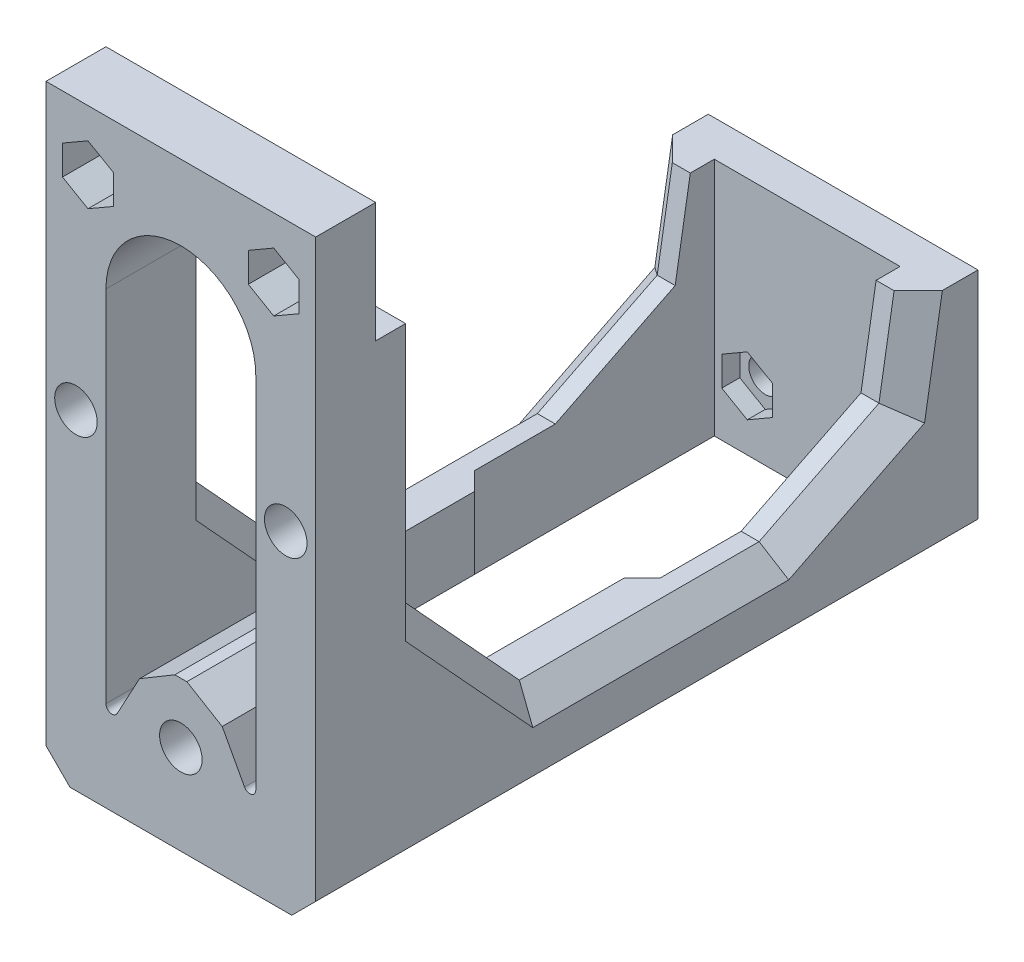
from build123d import *

# Parameters (mm, degrees)
SKETCH1_W               = 10
SKETCH1_H               = 110.5
BOSS_EXTRUDE1_DEPTH     = 100
BOSS_EXTRUDE1_2_DEPTH   = 100
SKETCH2_W               = 45
SKETCH2_H               = 40
BOSS_EXTRUDE2_DEPTH     = 6
CUT_EXTRUDE1_DEPTH      = 156.676748424
CUT_EXTRUDE1_DEPTH_BACK = 156.676748424
CHAMFER1_SIZE           = 4
CHAMFER2_SIZE           = 4
CUT_EXTRUDE2_DEPTH      = 151.71993896
CUT_EXTRUDE2_DEPTH_BACK = 6
SKETCH4_R               = 2.75
CUT_EXTRUDE3_DEPTH      = 10
CUT_EXTRUDE3_DEPTH_BACK = 3
CUT_EXTRUDE4_DEPTH      = 128.73605599
CUT_EXTRUDE4_DEPTH_BACK = 128.73605599
SKETCH6_W               = 31
SKETCH6_H               = 40
CHAMFER4_SIZE           = 3
BOSS_EXTRUDE3_DEPTH     = 15
CUT_EXTRUDE5_DEPTH      = 151.71993896
CUT_EXTRUDE5_DEPTH_BACK = 151.71993896
SKETCH8_R               = 2.75
CUT_EXTRUDE7_DEPTH      = 141.094610888
CUT_EXTRUDE7_DEPTH_BACK = 141.094610888
SKETCH10_R              = 3.55
SKETCH11_R              = 4.5
CUT_EXTRUDE8_DEPTH      = 6
SKETCH12_W              = 55.745552446
SKETCH12_H              = 24.52298679
CUT_EXTRUDE9_DEPTH      = 5
CUT_EXTRUDE6_DEPTH      = 7
BOSS_EXTRUDE4_START     = 3
SKETCH13_R              = 4.5
SKETCH13_R_2            = 2.75
BOSS_EXTRUDE4_DEPTH     = 3
BOSS_EXTRUDE5_DEPTH     = 20
CHAMFER5_SIZE           = 5
SKETCH15_R              = 2.75
CUT_EXTRUDE11_DEPTH     = 137.735145445
SKETCH16_R              = 3.55
CUT_EXTRUDE12_DEPTH     = 9
SKETCH17_R              = 5
CUT_EXTRUDE13_DEPTH     = 5
CHAMFER6_SIZE           = 4
FILLET1_R               = 1


# Some blends are built 0.0001 mm under size
with BuildPart() as part:
    # Sketch1 → Boss-Extrude1 (new body)
    with BuildSketch(Plane(origin=(0, 0, 0), x_dir=(1, 0, 0), z_dir=(0, 1, 0))):
        with Locations((-17.5, -55.25)):
            Rectangle(SKETCH1_W, SKETCH1_H)
    extrude(amount=BOSS_EXTRUDE1_DEPTH)



with BuildPart() as body_2:
    # Sketch1 → Boss-Extrude1 2 (new body)
    with BuildSketch(Plane(origin=(0, 0, 0), x_dir=(1, 0, 0), z_dir=(0, 1, 0))):
        with Locations((17.5, -55.25)):
            Rectangle(SKETCH1_W, SKETCH1_H)
    extrude(amount=BOSS_EXTRUDE1_2_DEPTH)


with BuildPart() as part_1:
    add(part.part)

    add(body_2.part)  # Boss-Extrude2 merges body 2
    # Sketch2 → Boss-Extrude2 (add)
    with BuildSketch(Plane(origin=(0, 0, 0), x_dir=(-1, 0, 0), z_dir=(0, 0, -1))):
        with Locations((0, 20)):
            Rectangle(SKETCH2_W, SKETCH2_H)
    extrude(amount=-BOSS_EXTRUDE2_DEPTH)

    # Sketch3 → Cut-Extrude1 (cut, two sides: drawn at the far end of the back side and taken through both)
    with BuildSketch(Plane.ZY.offset(22.5).offset(-CUT_EXTRUDE1_DEPTH_BACK)):
        Polygon((95.5, 121.142290582), (95.5, 40), (72.523677048, 15), (32.523677048, 15), (12.523677048, 25), (10, 40), (0, 40), (-7.984339434, 40), (-7.984339434, 121.142290582), align=None)
    extrude(amount=CUT_EXTRUDE1_DEPTH + CUT_EXTRUDE1_DEPTH_BACK, mode=Mode.SUBTRACT)

    # Chamfer1
    chamfer1_edges = [part_1.edges().sort_by_distance(p)[0] for p in [
        (-12.5, 27.5, 84.011838524),
        (12.5, 27.5, 84.011838524),
        (22.5, 32.5, 11.261838524),
        (22.5, 27.5, 84.011838524),
        (22.5, 15, 52.523677048),
        (22.5, 20, 22.523677048),
        (-22.5, 32.5, 11.261838524),
        (-22.5, 27.5, 84.011838524),
        (-22.5, 15, 52.523677048),
        (-22.5, 20, 22.523677048),
    ]]
    chamfer(chamfer1_edges, length=CHAMFER1_SIZE)

    # Chamfer2
    chamfer2_edges = [part_1.edges().sort_by_distance(p)[0] for p in [
        (22.5, 0, 55.25),
        (-22.5, 0, 55.25),
    ]]
    chamfer(chamfer2_edges, length=CHAMFER2_SIZE)

    # Sketch4 → Cut-Extrude2 (cut, two sides: drawn at the far end of the back side and taken through both)
    with BuildSketch(Plane(origin=(0, 0, 0), x_dir=(-1, 0, 0), z_dir=(0, 0, -1)).offset(-CUT_EXTRUDE2_DEPTH_BACK)):
        with Locations(Location((-10, 10, 0), (0, 0, 155.380022671))):
            Circle(SKETCH4_R)
        with Locations(Location((10, 10, 0), (0, 0, 335.380022671))):
            Circle(SKETCH4_R)
    extrude(amount=CUT_EXTRUDE2_DEPTH + CUT_EXTRUDE2_DEPTH_BACK, mode=Mode.SUBTRACT)

    # Sketch5 → Cut-Extrude3 (cut, two sides: drawn at the far end of the back side and taken through both)
    with BuildSketch(Plane.XY.offset(6).offset(-CUT_EXTRUDE3_DEPTH_BACK)):
        Polygon((-10, 14.907477288), (-14.25, 12.453738644), (-14.25, 7.546261356), (-10, 5.092522712), (-5.75, 7.546261356), (-5.75, 12.453738644), align=None)
        Polygon((10, 14.907477288), (5.75, 12.453738644), (5.75, 7.546261356), (10, 5.092522712), (14.25, 7.546261356), (14.25, 12.453738644), align=None)
    extrude(amount=CUT_EXTRUDE3_DEPTH + CUT_EXTRUDE3_DEPTH_BACK, mode=Mode.SUBTRACT)

    # Sketch6 → Cut-Extrude4 (cut, two sides: drawn at the far end of the back side and taken through both)
    with BuildSketch(Plane(origin=(0, 40, 0), x_dir=(1, 0, 0), z_dir=(0, 1, 0)).offset(-CUT_EXTRUDE4_DEPTH_BACK)):
        with Locations((0, -26)):
            Rectangle(SKETCH6_W, SKETCH6_H)
    extrude(amount=CUT_EXTRUDE4_DEPTH + CUT_EXTRUDE4_DEPTH_BACK, mode=Mode.SUBTRACT)

    # Chamfer4
    chamfer4_edges = [part_1.edges().sort_by_distance(p)[0] for p in [
        (12.5, 0, 78.25),
        (12.5, 7.5, 46),
        (-12.5, 0, 78.25),
        (-12.5, 7.5, 46),
    ]]
    chamfer(chamfer4_edges, length=CHAMFER4_SIZE - 0.0001)  # a hair under: the kernel refuses the full size

    # Sketch7 → Boss-Extrude3 (add)
    with BuildSketch(Plane.XY.offset(110.5)):
        with BuildLine():
            Line((-22.5, 100), (22.5, 100))
            Line((22.5, 100), (12.5, 75))
            ThreePointArc((12.5, 75), (0, 87.5), (-12.5, 75))
            Line((-12.5, 75), (-22.5, 100))
        make_face()
    extrude(amount=-BOSS_EXTRUDE3_DEPTH)

    # Sketch8 → Cut-Extrude5 (cut, two sides: drawn at the far end of the back side and taken through both)
    with BuildSketch(Plane.XY.offset(110.5).offset(-CUT_EXTRUDE5_DEPTH_BACK)):
        with Locations((-15.5, 90)):
            Circle(SKETCH8_R)
        with Locations((15.5, 90)):
            Circle(SKETCH8_R)
    extrude(amount=CUT_EXTRUDE5_DEPTH + CUT_EXTRUDE5_DEPTH_BACK, mode=Mode.SUBTRACT)

    # Sketch10 → Cut-Extrude7 (cut, two sides: drawn at the far end of the back side and taken through both)
    with BuildSketch(Plane(origin=(0, 0, 95.5), x_dir=(-1, 0, 0), z_dir=(0, 0, -1)).offset(-CUT_EXTRUDE7_DEPTH_BACK)):
        with Locations(Location((-17.5, 55, 0), (0, 0, 90))):
            Circle(SKETCH10_R)
        with Locations(Location((17.5, 55, 0), (0, 0, 90))):
            Circle(SKETCH10_R)
    extrude(amount=CUT_EXTRUDE7_DEPTH + CUT_EXTRUDE7_DEPTH_BACK, mode=Mode.SUBTRACT)

    # Sketch11 → Cut-Extrude8 (cut)
    with BuildSketch(Plane(origin=(0, 0, 95.5), x_dir=(-1, 0, 0), z_dir=(0, 0, -1))):
        with Locations(Location((-17.5, 55, 0), (0, 0, 90))):
            Circle(SKETCH11_R)
        with Locations(Location((17.5, 55, 0), (0, 0, 90))):
            Circle(SKETCH11_R)
    extrude(amount=-CUT_EXTRUDE8_DEPTH, mode=Mode.SUBTRACT)

    # Sketch12 → Cut-Extrude9 (cut)
    with BuildSketch(Plane(origin=(0, 0, 95.5), x_dir=(-1, 0, 0), z_dir=(0, 0, -1))):
        with Locations((0.490806416, 92.261493395)):
            Rectangle(SKETCH12_W, SKETCH12_H)
    extrude(amount=-CUT_EXTRUDE9_DEPTH, mode=Mode.SUBTRACT)

    # Sketch9 → Cut-Extrude6 (cut)
    with BuildSketch(Plane.XY.offset(110.5)):
        Polygon((-15.5, 94.907477288), (-19.75, 92.453738644), (-19.75, 87.546261356), (-15.5, 85.092522712), (-11.25, 87.546261356), (-11.25, 92.453738644), align=None)
        Polygon((15.5, 94.907477288), (11.25, 92.453738644), (11.25, 87.546261356), (15.5, 85.092522712), (19.75, 87.546261356), (19.75, 92.453738644), align=None)
    extrude(amount=-CUT_EXTRUDE6_DEPTH, mode=Mode.SUBTRACT)

    # Sketch13 → Boss-Extrude4 (add)
    # profile 1 of 2: a face of its own
    with BuildSketch(Plane(origin=(0, 0, 101.5), x_dir=(-1, 0, 0), z_dir=(0, 0, -1)).offset(BOSS_EXTRUDE4_START)):
        with Locations(Location((-17.5, 55, 0), (0, 0, 90))):
            Circle(SKETCH13_R)
        with Locations((-17.5, 55)):
            Circle(SKETCH13_R_2, mode=Mode.SUBTRACT)
    # profile 2 of 2: a face of its own
    with BuildSketch(Plane(origin=(0, 0, 101.5), x_dir=(-1, 0, 0), z_dir=(0, 0, -1)).offset(BOSS_EXTRUDE4_START)):
        with Locations(Location((17.5, 55, 0), (0, 0, 90))):
            Circle(SKETCH13_R)
        with Locations((17.5, 55)):
            Circle(SKETCH13_R_2, mode=Mode.SUBTRACT)
    extrude(amount=-BOSS_EXTRUDE4_DEPTH)

    # Sketch14 → Boss-Extrude5 (add)
    with BuildSketch(Plane.XY.offset(110.5)):
        Polygon((-5, 25), (5, 25), (18.5, 0), (-18.5, 0), align=None)
    extrude(amount=-BOSS_EXTRUDE5_DEPTH)

    # Chamfer5
    # the kernel refuses this chamfer: 5 mm, written as the material it takes off along each edge
    with BuildSketch(Plane(origin=(28.35831494, 0, 90.5), x_dir=(0, 0.9996219169112968, -0.0274958766105877), z_dir=(-1, 0, 0))) as chamfer5_piece_1_section:
        Polygon((CHAMFER5_SIZE * 0.999621916911, -CHAMFER5_SIZE * 0.0274958766106), (-CHAMFER5_SIZE * 0.0274958766106, -CHAMFER5_SIZE * 0.999621916911), (0, 0), align=None)
    chamfer5_piece_1 = extrude(amount=56.71662988, mode=Mode.PRIVATE)
    chamfer5_piece_1 = split(chamfer5_piece_1, bisect_by=Plane(origin=(14.159547874, 1.340352126, 92.611977199), z_dir=(-0.7071067811865475, -0.7071067811865476, 0)), keep=Keep.TOP, mode=Mode.PRIVATE)
    chamfer5_piece_1 = split(chamfer5_piece_1, bisect_by=Plane(origin=(12.5, 0.787169501, 92.611977199), z_dir=(1, 0, 0)), keep=Keep.TOP, mode=Mode.PRIVATE)
    add(chamfer5_piece_1, mode=Mode.SUBTRACT)
    with BuildSketch(Plane(origin=(28.35831494, 0, 90.5), x_dir=(0, 0.9996219169112968, -0.0274958766105877), z_dir=(-1, 0, 0))) as chamfer5_piece_2_section:
        Polygon((CHAMFER5_SIZE * 0.999621916911, -CHAMFER5_SIZE * 0.0274958766106), (-CHAMFER5_SIZE * 0.0274958766106, -CHAMFER5_SIZE * 0.999621916911), (0, 0), align=None)
    chamfer5_piece_2 = extrude(amount=56.71662988, mode=Mode.PRIVATE)
    chamfer5_piece_2 = split(chamfer5_piece_2, bisect_by=Plane(origin=(11.6635791, 3.8363209, 90.857133188), z_dir=(0.7071067811865475, 0.7071067811865476, 0)), keep=Keep.TOP, mode=Mode.PRIVATE)
    chamfer5_piece_2 = split(chamfer5_piece_2, bisect_by=Plane(origin=(12.5, 4.115127867, 90.857133188), z_dir=(-1, 0, 0)), keep=Keep.TOP, mode=Mode.PRIVATE)
    add(chamfer5_piece_2, mode=Mode.SUBTRACT)
    with BuildSketch(Plane(origin=(28.35831494, 0, 90.5), x_dir=(0, 0.9996219169112968, -0.0274958766105877), z_dir=(-1, 0, 0))) as chamfer5_piece_3_section:
        Polygon((CHAMFER5_SIZE * 0.999621916911, -CHAMFER5_SIZE * 0.0274958766106), (-CHAMFER5_SIZE * 0.0274958766106, -CHAMFER5_SIZE * 0.999621916911), (0, 0), align=None)
    chamfer5_piece_3 = extrude(amount=56.71662988, mode=Mode.PRIVATE)
    chamfer5_piece_3 = split(chamfer5_piece_3, bisect_by=Plane(origin=(-6.938143238, 8.561756762, 92.162249501), z_dir=(0.7071067811865475, -0.7071067811865476, 0)), keep=Keep.TOP, mode=Mode.PRIVATE)
    chamfer5_piece_3 = split(chamfer5_piece_3, bisect_by=Plane(origin=(-12.5, 1.623613523, 92.162249501), z_dir=(1, 0, 0)), keep=Keep.TOP, mode=Mode.PRIVATE)
    chamfer5_piece_3 = split(chamfer5_piece_3, bisect_by=Plane(origin=(6.938143238, 8.561756762, 92.162249501), z_dir=(-0.7071067811865475, -0.7071067811865476, 0)), keep=Keep.TOP, mode=Mode.PRIVATE)
    chamfer5_piece_3 = split(chamfer5_piece_3, bisect_by=Plane(origin=(12.5, 1.623613523, 92.162249501), z_dir=(-1, 0, 0)), keep=Keep.TOP, mode=Mode.PRIVATE)
    add(chamfer5_piece_3, mode=Mode.SUBTRACT)
    with BuildSketch(Plane(origin=(28.35831494, 0, 90.5), x_dir=(0, 0.9996219169112968, -0.0274958766105877), z_dir=(-1, 0, 0))) as chamfer5_piece_4_section:
        Polygon((CHAMFER5_SIZE * 0.999621916911, -CHAMFER5_SIZE * 0.0274958766106), (-CHAMFER5_SIZE * 0.0274958766106, -CHAMFER5_SIZE * 0.999621916911), (0, 0), align=None)
    chamfer5_piece_4 = extrude(amount=56.71662988, mode=Mode.PRIVATE)
    chamfer5_piece_4 = split(chamfer5_piece_4, bisect_by=Plane(origin=(-14.159547874, 1.340352126, 92.611977199), z_dir=(0.7071067811865475, -0.7071067811865476, 0)), keep=Keep.TOP, mode=Mode.PRIVATE)
    chamfer5_piece_4 = split(chamfer5_piece_4, bisect_by=Plane(origin=(-12.5, 0.787169501, 92.611977199), z_dir=(-1, 0, 0)), keep=Keep.TOP, mode=Mode.PRIVATE)
    add(chamfer5_piece_4, mode=Mode.SUBTRACT)
    with BuildSketch(Plane(origin=(28.35831494, 0, 90.5), x_dir=(0, 0.9996219169112968, -0.0274958766105877), z_dir=(-1, 0, 0))) as chamfer5_piece_5_section:
        Polygon((CHAMFER5_SIZE * 0.999621916911, -CHAMFER5_SIZE * 0.0274958766106), (-CHAMFER5_SIZE * 0.0274958766106, -CHAMFER5_SIZE * 0.999621916911), (0, 0), align=None)
    chamfer5_piece_5 = extrude(amount=56.71662988, mode=Mode.PRIVATE)
    chamfer5_piece_5 = split(chamfer5_piece_5, bisect_by=Plane(origin=(-11.6635791, 3.8363209, 90.857133188), z_dir=(-0.7071067811865475, 0.7071067811865476, 0)), keep=Keep.TOP, mode=Mode.PRIVATE)
    chamfer5_piece_5 = split(chamfer5_piece_5, bisect_by=Plane(origin=(-12.5, 4.115127867, 90.857133188), z_dir=(1, 0, 0)), keep=Keep.TOP, mode=Mode.PRIVATE)
    add(chamfer5_piece_5, mode=Mode.SUBTRACT)

    # Sketch15 → Cut-Extrude11 (cut, through all)
    with BuildSketch(Plane(origin=(0, 0, 90.5), x_dir=(-1, 0, 0), z_dir=(0, 0, -1))):
        with Locations((0, 15)):
            Circle(SKETCH15_R)
    extrude(amount=-CUT_EXTRUDE11_DEPTH, mode=Mode.SUBTRACT)

    # Sketch16 → Cut-Extrude12 (cut)
    with BuildSketch(Plane.XY.offset(110.5)):
        with Locations((0, 15)):
            Circle(SKETCH16_R)
    extrude(amount=-CUT_EXTRUDE12_DEPTH, mode=Mode.SUBTRACT)

    # Sketch17 → Cut-Extrude13 (cut)
    with BuildSketch(Plane(origin=(0, 0, 90.5), x_dir=(-1, 0, 0), z_dir=(0, 0, -1))):
        with Locations((0, 15)):
            Circle(SKETCH17_R)
    extrude(amount=-CUT_EXTRUDE13_DEPTH, mode=Mode.SUBTRACT)

    # Chamfer6
    chamfer6_edges = [part_1.edges().sort_by_distance(p)[0] for p in [
        (5, 25, 100.5),
        (-5, 25, 100.5),
    ]]
    chamfer(chamfer6_edges, length=CHAMFER6_SIZE)

    # Fillet1
    fillet1_edges = [part_1.edges().sort_by_distance(p)[0] for p in [
        (12.5, 11.111111111, 100.5),
        (-12.5, 11.111111111, 100.5),
    ]]
    fillet(fillet1_edges, radius=FILLET1_R)


solid = part_1.part
